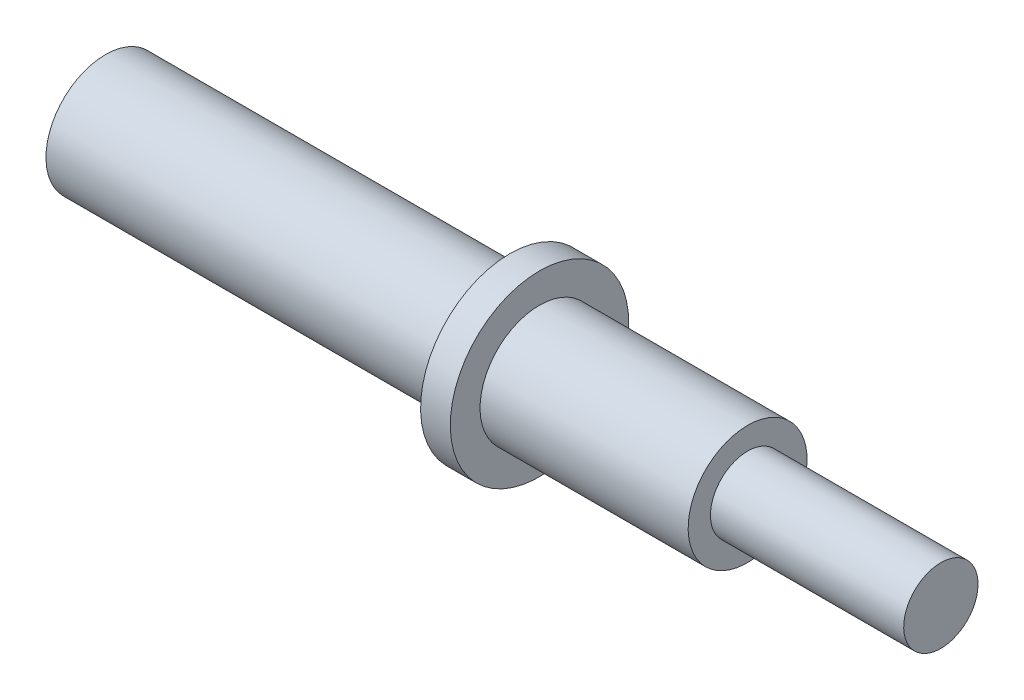
from build123d import *


with BuildPart() as part:
    # Sketch2 → Revolve1 (revolve)
    with BuildSketch(Plane.XY):
        Polygon((-28.1, 4), (-0.9, 4), (-0.9, 6), (1.1, 6), (1.1, 4), (15.1, 4), (15.1, 2.5), (28.1, 2.5), (28.1, 0), (-28.1, 0), align=None)
    revolve(axis=Axis((28.1, 0, 0), (-1, 0, 0)))


solid = part.part
